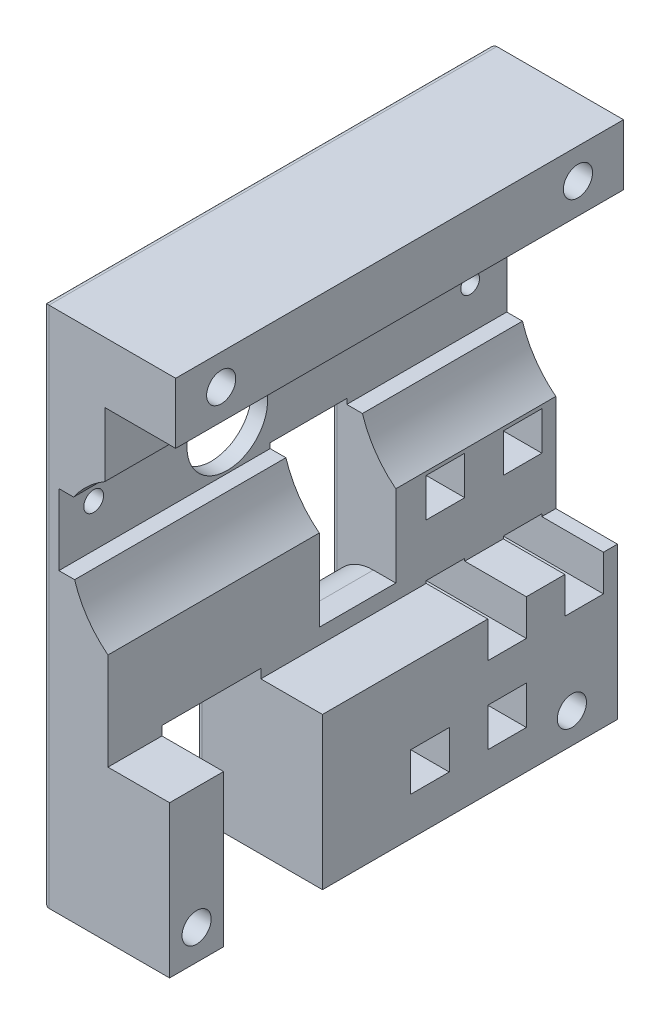
from build123d import *

# Parameters (mm, degrees)
PROFILEEXTRUDE_DEPTH    = 73.76
HOSEWINDOW_W            = 16.29
HOSEWINDOW_H            = 26.5
HOSEWINDOWCUT_DEPTH     = 95.103476042
CAGESCREWS_R            = 2.4
CAGESCREWSCUT_DEPTH     = 95.103476042
AXLEHOLECUT_DEPTH       = 95.103476042
SETSCREWHOLES_R         = 1.539432213
SETSCREWHOLES_R_2       = 1.628953018
SETSCREWHOLESCUT_DEPTH  = 95.10347612
VELOCITYWINDOW_W        = 12.61
VELOCITYWINDOW_H        = 22.29
VELOCITYWINDOWCUT_DEPTH = 95.10347612
FILLET3_R               = 7
TRIGGERRACKSLOTCUT_W    = 6.35
TRIGGERRACKSLOTCUT_H    = 6.35
RACKSLOTCUT_DEPTH       = 95.10347612
FILLET4_R               = 1


with BuildPart() as part:
    # Profile → ProfileExtrude (new body)
    with BuildSketch(Plane.XY):
        with BuildLine():
            Line((9.301269376, -54.194713793), (9.301269376, -29.194713793))
            Line((9.301269376, -29.194713793), (-0.848730624, -29.194713793))
            Line((-0.848730624, -29.194713793), (-0.848730624, -13.196583793))
            ThreePointArc((-0.848730624, -13.196583793), (-4.204324299, -9.619560571), (-6.340730624, -5.204713793))
            Line((-6.340730624, -5.204713793), (-8.928730624, -5.204713793))
            Line((-8.928730624, -5.204713793), (-8.928730624, 6.495286207))
            Line((-8.928730624, 6.495286207), (-6.509650624, 6.495286207))
            ThreePointArc((-6.509650624, 6.495286207), (-4.191428492, 9.172059076), (-1.348730624, 11.283536207))
            Line((-1.348730624, 11.283536207), (-1.348730624, 21.845286207))
            Line((-1.348730624, 21.845286207), (10.301269376, 21.845286207))
            Line((10.301269376, 21.845286207), (10.301269376, 31.845286207))
            Line((10.301269376, 31.845286207), (-11.558730624, 31.845286207))
            Line((-11.558730624, 31.845286207), (-11.558730624, -54.194713793))
            Line((-11.558730624, -54.194713793), (9.301269376, -54.194713793))
        make_face()
    extrude(amount=PROFILEEXTRUDE_DEPTH)

    # HoseWindow → HoseWindowCut (cut, through all)
    with BuildSketch(Plane.ZY.offset(11.558730624)):
        with Locations((56.725, -40.944713793)):
            Rectangle(HOSEWINDOW_W, HOSEWINDOW_H)
    extrude(amount=-HOSEWINDOWCUT_DEPTH, mode=Mode.SUBTRACT)

    # CageScrews → CageScrewsCut (cut, through all)
    with BuildSketch(Plane.ZY.offset(11.558730624)):
        with Locations((7.5, 26.845286207)):
            Circle(CAGESCREWS_R)
        with Locations((66.26, 26.845286207)):
            Circle(CAGESCREWS_R)
        with Locations((7.5, -49.194713793)):
            Circle(CAGESCREWS_R)
        with Locations((69.31, -49.194713793)):
            Circle(CAGESCREWS_R)
    extrude(amount=-CAGESCREWSCUT_DEPTH, mode=Mode.SUBTRACT)

    # AxleHole → AxleHoleCut (cut, through all)
    with BuildSketch(Plane.ZY.offset(11.558730624)):
        with BuildLine():
            Line((47.361, 8.359497151), (47.361, 6.740497151))
            Line((47.361, 6.740497151), (44.699, 6.740497151))
            Line((44.699, 6.740497151), (44.699, 8.359497151))
            ThreePointArc((44.699, 8.359497151), (46.03, -4.783713793), (47.361, 8.359497151))
        make_face()
    extrude(amount=-AXLEHOLECUT_DEPTH, mode=Mode.SUBTRACT)

    # SetScrewHoles → SetScrewHolesCut (cut, through all)
    with BuildSketch(Plane.ZY.offset(11.558730624)):
        with Locations((6.03, 1.855286207)):
            Circle(SETSCREWHOLES_R)
        with Locations((68.03, 1.855286207)):
            Circle(SETSCREWHOLES_R_2)
    extrude(amount=-SETSCREWHOLESCUT_DEPTH, mode=Mode.SUBTRACT)

    # VelocityWindow → VelocityWindowCut (cut, through all)
    with BuildSketch(Plane.ZY.offset(11.558730624)):
        with Locations((32.655, -15.499713793)):
            Rectangle(VELOCITYWINDOW_W, VELOCITYWINDOW_H)
    extrude(amount=-VELOCITYWINDOWCUT_DEPTH, mode=Mode.SUBTRACT)

    # Fillet3
    fillet3_edges = [part.edges().sort_by_distance(p)[0] for p in [
        (-11.558730624, -26.644713793, 32.655),
    ]]
    fillet(fillet3_edges, radius=FILLET3_R)

    # TriggerRackSlotCut → RackSlotCut (cut, through all)
    with BuildSketch(Plane.ZY.offset(11.558730624)):
        with Locations((18.175, -44.669713793)):
            Rectangle(TRIGGERRACKSLOTCUT_W, TRIGGERRACKSLOTCUT_H)
        with Locations((30.875, -44.669713793)):
            Rectangle(TRIGGERRACKSLOTCUT_W, TRIGGERRACKSLOTCUT_H)
        with Locations((5.475, -31.969713793)):
            Rectangle(TRIGGERRACKSLOTCUT_W, TRIGGERRACKSLOTCUT_H)
        with Locations((18.175, -31.969713793)):
            Rectangle(TRIGGERRACKSLOTCUT_W, TRIGGERRACKSLOTCUT_H)
        with Locations((5.475, -16.969713793)):
            Rectangle(TRIGGERRACKSLOTCUT_W, TRIGGERRACKSLOTCUT_H)
        with Locations((18.175, -16.969713793)):
            Rectangle(TRIGGERRACKSLOTCUT_W, TRIGGERRACKSLOTCUT_H)
    extrude(amount=-RACKSLOTCUT_DEPTH, mode=Mode.SUBTRACT)

    # Fillet4
    fillet4_edges = [part.edges().sort_by_distance(p)[0] for p in [
        (-11.558730624, -16.969713793, 15),
        (-11.558730624, -20.144713793, 18.175),
        (-11.558730624, -16.969713793, 21.35),
        (-11.558730624, -13.794713793, 18.175),
        (-11.558730624, -13.794713793, 5.475),
        (-11.558730624, -16.969713793, 2.3),
        (-11.558730624, -16.969713793, 8.65),
        (-11.558730624, -20.144713793, 5.475),
        (-11.558730624, -35.144713793, 5.475),
        (-11.558730624, -31.969713793, 2.3),
        (-11.558730624, -28.794713793, 5.475),
        (-11.558730624, -31.969713793, 8.65),
        (-11.558730624, -31.969713793, 21.35),
        (-11.558730624, -28.794713793, 18.175),
        (-11.558730624, -31.969713793, 15),
        (-11.558730624, -35.144713793, 18.175),
        (-11.558730624, -47.844713793, 18.175),
        (-11.558730624, -44.669713793, 15),
        (-11.558730624, -41.494713793, 18.175),
        (-11.558730624, -44.669713793, 21.35),
        (-11.558730624, -44.669713793, 27.7),
        (-11.558730624, -47.844713793, 30.875),
        (-11.558730624, -44.669713793, 34.05),
        (-11.558730624, -41.494713793, 30.875),
        (-11.558730624, -18.999713793, 38.96),
        (-11.558730624, -4.354713793, 32.655),
        (-11.558730624, -18.999713793, 26.35),
        (-11.558730624, -11.174713793, 0),
        (-11.558730624, -54.194713793, 24.29),
        (-11.558730624, -40.944713793, 48.58),
        (-11.558730624, -27.694713793, 56.725),
        (-11.558730624, -40.944713793, 64.87),
        (-11.558730624, -54.194713793, 69.315),
        (-11.558730624, -11.174713793, 73.76),
        (-11.558730624, 31.845286207, 36.88),
    ]]
    fillet(fillet4_edges, radius=FILLET4_R)


solid = part.part
